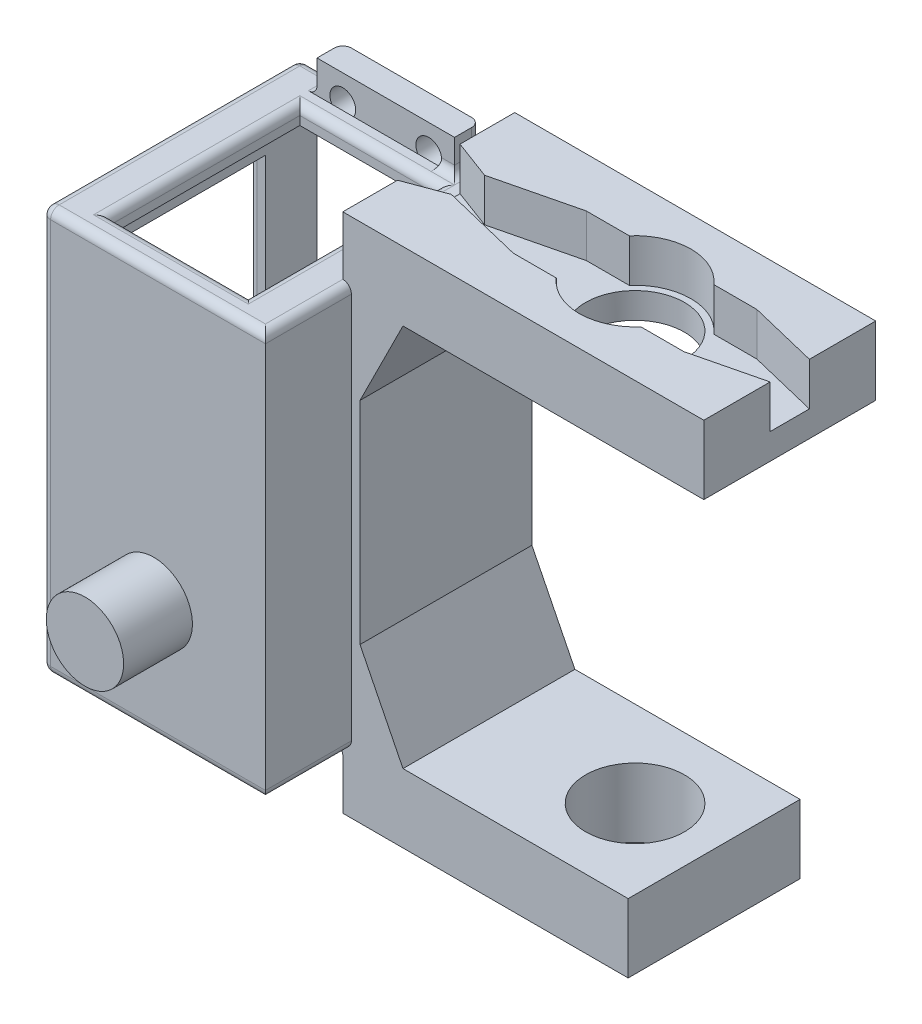
from build123d import *

# Parameters (mm, degrees)
SKETCH1_W               = 26
SKETCH1_H               = 47
BOSS_EXTRUDE1_DEPTH     = 30
SHELL1_T                = -2
SKETCH2_W               = 10
SKETCH2_H               = 0.8
BOSS_EXTRUDE2_DEPTH     = 3
SKETCH3_R               = 1.5
CUT_EXTRUDE1_DEPTH      = 3
BOSS_EXTRUDE3_DEPTH     = 20
CUT_EXTRUDE2_DEPTH      = 82.134209801
CUT_EXTRUDE2_DEPTH_BACK = 82.134209801
SKETCH6_R               = 4.5
BOSS_EXTRUDE4_DEPTH     = 8
CUT_EXTRUDE3_DEPTH      = 82.917275345
CUT_EXTRUDE3_DEPTH_BACK = 82.917275345
SKETCH9_R               = 5.75
CUT_EXTRUDE4_DEPTH      = 5
SKETCH10_W              = 18
SKETCH10_H              = 35
CUT_EXTRUDE5_DEPTH      = 5
FILLET1_R               = 1
FILLET2_R               = 1
FILLET3_R               = 1
FILLET5_R               = 1
FILLET6_R               = 1
SKETCH11_W              = 8.801922924
SKETCH11_H              = 20
CUT_EXTRUDE6_DEPTH      = 10
SKETCH12_R              = 109.313079142
CUT_EXTRUDE7_DEPTH      = 73.650464555


# Some blends are built 0.0001 mm under size
with BuildPart() as part:
    # Sketch1 → Boss-Extrude1 (new body)
    with BuildSketch(Plane.XY):
        Rectangle(SKETCH1_W, SKETCH1_H)
    extrude(amount=BOSS_EXTRUDE1_DEPTH)

    # Shell1
    shell1_openings = [part.faces().sort_by_distance(p)[0] for p in [
        (0, 0, 30),
    ]]
    offset(amount=SHELL1_T, openings=shell1_openings, kind=Kind.INTERSECTION)

    # Sketch2 → Boss-Extrude2 (add)
    with BuildSketch(Plane.XY.offset(30)):
        Polygon((-5, 23.5), (-5, 24.3), (5, 24.3), (5, 23.5), (8, 23.5), (8, 27.3), (-8, 27.3), (-8, 23.5), align=None)
        with Locations((0, 23.9)):
            Rectangle(SKETCH2_W, SKETCH2_H)
        Polygon((-5, -24.3), (-5, -23.5), (-8, -23.5), (-8, -27.3), (8, -27.3), (8, -23.5), (5, -23.5), (5, -24.3), align=None)
        with Locations((0, -23.9)):
            Rectangle(SKETCH2_W, SKETCH2_H)
    extrude(amount=-BOSS_EXTRUDE2_DEPTH)

    # Sketch3 → Cut-Extrude1 (cut)
    with BuildSketch(Plane.XY.offset(30)):
        with Locations((-5, -24.3)):
            Circle(SKETCH3_R)
        with Locations((5, -24.3)):
            Circle(SKETCH3_R)
        with Locations((5, 24.3)):
            Circle(SKETCH3_R)
        with Locations((-5, 24.3)):
            Circle(SKETCH3_R)
    extrude(amount=-CUT_EXTRUDE1_DEPTH, mode=Mode.SUBTRACT)

    # Sketch4 → Boss-Extrude3 (add)
    with BuildSketch(Plane.XY.offset(30)):
        Polygon((13, 23.5), (13, -23.5), (12, -23.5), (12, -30.3), (54, -30.3), (54, -22.3), (19, -22.3), (14, -12.3), (14, 12.3), (19, 22.3), (54, 22.3), (54, 30.3), (12, 30.3), (12, 23.5), align=None)
    extrude(amount=-BOSS_EXTRUDE3_DEPTH)

    # Sketch5 → Cut-Extrude2 (cut, two sides: drawn at the far end of the back side and taken through both)
    with BuildSketch(Plane(origin=(0, 22.3, 0), x_dir=(-1, 0, 0), z_dir=(0, -1, 0)).offset(-CUT_EXTRUDE2_DEPTH_BACK)):
        with BuildLine():
            ThreePointArc((-36, -14.25), (-41.75, -20), (-36, -25.75))
            Line((-36, -25.75), (-36, -14.25))
        make_face()
        with BuildLine():
            Line((-36, -14.25), (-36, -25.75))
            ThreePointArc((-36, -25.75), (-31.934136008, -24.065863992), (-30.25, -20))
            ThreePointArc((-30.25, -20), (-31.934136008, -15.934136008), (-36, -14.25))
        make_face()
    extrude(amount=CUT_EXTRUDE2_DEPTH + CUT_EXTRUDE2_DEPTH_BACK, mode=Mode.SUBTRACT)

    # Sketch6 → Boss-Extrude4 (add)
    with BuildSketch(Plane(origin=(0, 0, 0), x_dir=(-1, 0, 0), z_dir=(0, 0, -1))):
        with Locations((0, -10)):
            Circle(SKETCH6_R)
    extrude(amount=BOSS_EXTRUDE4_DEPTH)

    # Sketch7 → Cut-Extrude3 (cut, two sides: drawn at the far end of the back side and taken through both)
    with BuildSketch(Plane(origin=(0, 23.5, 0), x_dir=(1, 0, 0), z_dir=(0, 1, 0)).offset(-CUT_EXTRUDE3_DEPTH_BACK)):
        Polygon((-8, -25), (8, -25), (8, -23), (8, -5), (8, -3), (-8, -3), (-8, -5), (-8, -23), align=None)
    extrude(amount=CUT_EXTRUDE3_DEPTH + CUT_EXTRUDE3_DEPTH_BACK, mode=Mode.SUBTRACT)

    # Sketch9 → Cut-Extrude4 (cut)
    with BuildSketch(Plane(origin=(0, 30.3, 0), x_dir=(1, 0, 0), z_dir=(0, 1, 0))):
        with BuildLine():
            Line((31.081921107, -15.75), (26.081921107, -15.75))
            Line((26.081921107, -15.75), (16.559525756, -18.066028235))
            Line((16.559525756, -18.066028235), (12, -16.361741342))
            Line((12, -16.361741342), (12, -23.638258658))
            Line((12, -23.638258658), (16.559525756, -21.933971765))
            Line((16.559525756, -21.933971765), (26.081921107, -24.25))
            Line((26.081921107, -24.25), (31.081921107, -24.25))
            ThreePointArc((31.081921107, -24.25), (36, -26.5), (40.918078893, -24.25))
            Line((40.918078893, -24.25), (45.918078893, -24.25))
            Line((45.918078893, -24.25), (54, -22.284322585))
            Line((54, -22.284322585), (54, -17.715677415))
            Line((54, -17.715677415), (45.918078893, -15.75))
            Line((45.918078893, -15.75), (40.918078893, -15.75))
            ThreePointArc((40.918078893, -15.75), (36, -13.5), (31.081921107, -15.75))
        make_face()
        with Locations(Location((36, -20, 0), (0, 0, 90))):
            Circle(SKETCH9_R, mode=Mode.SUBTRACT)
    extrude(amount=-CUT_EXTRUDE4_DEPTH, mode=Mode.SUBTRACT)

    # Sketch10 → Cut-Extrude5 (cut)
    with BuildSketch(Plane.ZY.offset(13)):
        with Locations((15, 0)):
            Rectangle(SKETCH10_W, SKETCH10_H)
    extrude(amount=-CUT_EXTRUDE5_DEPTH, mode=Mode.SUBTRACT)

    # Fillet1
    fillet1_edges = [part.edges().sort_by_distance(p)[0] for p in [
        (0, -21.5, 30),
        (-13, 17.5, 15),
        (-13, 0, 24),
        (-13, 0, 6),
        (-13, -17.5, 15),
    ]]
    fillet(fillet1_edges, radius=FILLET1_R)

    # Fillet2
    # the kernel refuses this fillet: 1 mm, written as the material it adds along each edge
    with BuildSketch(Plane(origin=(8, 23.5, 30), x_dir=(1, 0, 0), z_dir=(0, 0, -1))) as fillet2_piece_1:
        with BuildLine():
            CenterArc((FILLET2_R, -FILLET2_R), FILLET2_R, 90, 90)
            Line((0, -FILLET2_R), (-FILLET2_R * 0.02, -FILLET2_R))
            Line((-FILLET2_R * 0.02, -FILLET2_R), (-FILLET2_R * 0.02, FILLET2_R * 0.02))
            Line((-FILLET2_R * 0.02, FILLET2_R * 0.02), (FILLET2_R, FILLET2_R * 0.02))
            Line((FILLET2_R, FILLET2_R * 0.02), (FILLET2_R, 0))
        make_face()
    extrude(amount=3)
    with BuildSketch(Plane(origin=(-8, 23.5, 30), x_dir=(-1, 0, 0), z_dir=(0, 0, -1))) as fillet2_piece_2:
        with BuildLine():
            CenterArc((FILLET2_R, FILLET2_R), FILLET2_R, 180, 90)
            Line((0, FILLET2_R), (-FILLET2_R * 0.02, FILLET2_R))
            Line((-FILLET2_R * 0.02, FILLET2_R), (-FILLET2_R * 0.02, -FILLET2_R * 0.02))
            Line((-FILLET2_R * 0.02, -FILLET2_R * 0.02), (FILLET2_R, -FILLET2_R * 0.02))
            Line((FILLET2_R, -FILLET2_R * 0.02), (FILLET2_R, 0))
        make_face()
    extrude(amount=3)
    with BuildSketch(Plane(origin=(3.768857754, 23.5, 27), x_dir=(0, 0, -1), z_dir=(1, 0, 0))) as fillet2_piece_3_section:
        with BuildLine():
            CenterArc((FILLET2_R, FILLET2_R), FILLET2_R, 180, 90)
            Line((0, FILLET2_R), (-FILLET2_R * 0.02, FILLET2_R))
            Line((-FILLET2_R * 0.02, FILLET2_R), (-FILLET2_R * 0.02, -FILLET2_R * 0.02))
            Line((-FILLET2_R * 0.02, -FILLET2_R * 0.02), (FILLET2_R, -FILLET2_R * 0.02))
            Line((FILLET2_R, -FILLET2_R * 0.02), (FILLET2_R, 0))
        make_face()
    fillet2_piece_3 = extrude(amount=4.231142246, mode=Mode.PRIVATE)
    fillet2_piece_3 = split(fillet2_piece_3, bisect_by=Plane(origin=(7.179036581, 23.695460756, 27), z_dir=(0, 0, -1)), keep=Keep.TOP, mode=Mode.PRIVATE)
    fillet2_piece_3 = fillet2_piece_3 - Plane(origin=(5, 24.3, 26.747269996), x_dir=(1, 0, 0), z_dir=(0, 0, 1)) * Cylinder(1.5, 13, mode=Mode.PRIVATE)
    add(fillet2_piece_3)
    with BuildSketch(Plane(origin=(12, -23.5, 30), x_dir=(0, -1, 0), z_dir=(0, 0, -1))) as fillet2_piece_4:
        with BuildLine():
            CenterArc((FILLET2_R, FILLET2_R), FILLET2_R, 180, 90)
            Line((0, FILLET2_R), (-FILLET2_R * 0.02, FILLET2_R))
            Line((-FILLET2_R * 0.02, FILLET2_R), (-FILLET2_R * 0.02, -FILLET2_R * 0.02))
            Line((-FILLET2_R * 0.02, -FILLET2_R * 0.02), (FILLET2_R, -FILLET2_R * 0.02))
            Line((FILLET2_R, -FILLET2_R * 0.02), (FILLET2_R, 0))
        make_face()
    extrude(amount=20)
    with BuildSketch(Plane(origin=(8, 23.5, 30), x_dir=(1, 0, 0), z_dir=(0, 0, -1))) as fillet2_piece_5a_section:
        with BuildLine():
            CenterArc((FILLET2_R, -FILLET2_R), FILLET2_R, 90, 90)
            Line((0, -FILLET2_R), (-FILLET2_R * 0.02, -FILLET2_R))
            Line((-FILLET2_R * 0.02, -FILLET2_R), (-FILLET2_R * 0.02, FILLET2_R * 0.02))
            Line((-FILLET2_R * 0.02, FILLET2_R * 0.02), (FILLET2_R, FILLET2_R * 0.02))
            Line((FILLET2_R, FILLET2_R * 0.02), (FILLET2_R, 0))
        make_face()
    fillet2_piece_5a = extrude(amount=5.5, mode=Mode.PRIVATE)
    fillet2_piece_5a = split(fillet2_piece_5a, bisect_by=Plane(origin=(8.226395114, 23.726395114, 27), z_dir=(0, 0, -1)), keep=Keep.TOP, mode=Mode.PRIVATE)
    with BuildSketch(Plane(origin=(3.768857754, 23.5, 27), x_dir=(0, 0, -1), z_dir=(1, 0, 0))) as fillet2_piece_5b_section:
        with BuildLine():
            CenterArc((FILLET2_R, FILLET2_R), FILLET2_R, 180, 90)
            Line((0, FILLET2_R), (-FILLET2_R * 0.02, FILLET2_R))
            Line((-FILLET2_R * 0.02, FILLET2_R), (-FILLET2_R * 0.02, -FILLET2_R * 0.02))
            Line((-FILLET2_R * 0.02, -FILLET2_R * 0.02), (FILLET2_R, -FILLET2_R * 0.02))
            Line((FILLET2_R, -FILLET2_R * 0.02), (FILLET2_R, 0))
        make_face()
    fillet2_piece_5b = extrude(amount=6.731142246, mode=Mode.PRIVATE)
    fillet2_piece_5b = split(fillet2_piece_5b, bisect_by=Plane(origin=(9.25, 23.70347313, 27), z_dir=(0, 0, -1)), keep=Keep.TOP, mode=Mode.PRIVATE)
    fillet2_piece_5b = split(fillet2_piece_5b, bisect_by=Plane(origin=(8, 23.70347313, 26.75304895), z_dir=(1, 0, 0)), keep=Keep.TOP, mode=Mode.PRIVATE)
    fillet2_piece_5 = fillet2_piece_5a & fillet2_piece_5b
    add(fillet2_piece_5)

    # Fillet3
    # the kernel refuses this fillet: 1 mm, written as the material it adds along each edge
    with BuildSketch(Plane(origin=(-8, -23.5, 30), x_dir=(-1, 0, 0), z_dir=(0, 0, -1))) as fillet3_piece_1:
        with BuildLine():
            CenterArc((FILLET3_R, -FILLET3_R), FILLET3_R, 90, 90)
            Line((0, -FILLET3_R), (-FILLET3_R * 0.02, -FILLET3_R))
            Line((-FILLET3_R * 0.02, -FILLET3_R), (-FILLET3_R * 0.02, FILLET3_R * 0.02))
            Line((-FILLET3_R * 0.02, FILLET3_R * 0.02), (FILLET3_R, FILLET3_R * 0.02))
            Line((FILLET3_R, FILLET3_R * 0.02), (FILLET3_R, 0))
        make_face()
    extrude(amount=3)
    with BuildSketch(Plane(origin=(8, -23.5, 30), x_dir=(1, 0, 0), z_dir=(0, 0, -1))) as fillet3_piece_2:
        with BuildLine():
            CenterArc((FILLET3_R, FILLET3_R), FILLET3_R, 180, 90)
            Line((0, FILLET3_R), (-FILLET3_R * 0.02, FILLET3_R))
            Line((-FILLET3_R * 0.02, FILLET3_R), (-FILLET3_R * 0.02, -FILLET3_R * 0.02))
            Line((-FILLET3_R * 0.02, -FILLET3_R * 0.02), (FILLET3_R, -FILLET3_R * 0.02))
            Line((FILLET3_R, -FILLET3_R * 0.02), (FILLET3_R, 0))
        make_face()
    extrude(amount=3)
    with BuildSketch(Plane(origin=(-3.768857754, -23.5, 27), x_dir=(0, 0, -1), z_dir=(-1, 0, 0))) as fillet3_piece_3_section:
        with BuildLine():
            CenterArc((FILLET3_R, FILLET3_R), FILLET3_R, 180, 90)
            Line((0, FILLET3_R), (-FILLET3_R * 0.02, FILLET3_R))
            Line((-FILLET3_R * 0.02, FILLET3_R), (-FILLET3_R * 0.02, -FILLET3_R * 0.02))
            Line((-FILLET3_R * 0.02, -FILLET3_R * 0.02), (FILLET3_R, -FILLET3_R * 0.02))
            Line((FILLET3_R, -FILLET3_R * 0.02), (FILLET3_R, 0))
        make_face()
    fillet3_piece_3 = extrude(amount=4.231142246, mode=Mode.PRIVATE)
    fillet3_piece_3 = split(fillet3_piece_3, bisect_by=Plane(origin=(-7.179037039, -23.695460726, 27), z_dir=(0, 0, -1)), keep=Keep.TOP, mode=Mode.PRIVATE)
    fillet3_piece_3 = fillet3_piece_3 - Plane(origin=(-5, -24.3, 26.747269962), x_dir=(1, 0, 0), z_dir=(0, 0, 1)) * Cylinder(1.5, 13, mode=Mode.PRIVATE)
    add(fillet3_piece_3)
    with BuildSketch(Plane(origin=(-3.768857754, -23.5, 27), x_dir=(0, 0, -1), z_dir=(-1, 0, 0))) as fillet3_piece_4a_section:
        with BuildLine():
            CenterArc((FILLET3_R, FILLET3_R), FILLET3_R, 180, 90)
            Line((0, FILLET3_R), (-FILLET3_R * 0.02, FILLET3_R))
            Line((-FILLET3_R * 0.02, FILLET3_R), (-FILLET3_R * 0.02, -FILLET3_R * 0.02))
            Line((-FILLET3_R * 0.02, -FILLET3_R * 0.02), (FILLET3_R, -FILLET3_R * 0.02))
            Line((FILLET3_R, -FILLET3_R * 0.02), (FILLET3_R, 0))
        make_face()
    fillet3_piece_4a = extrude(amount=6.731142246, mode=Mode.PRIVATE)
    fillet3_piece_4a = split(fillet3_piece_4a, bisect_by=Plane(origin=(-9.25, -23.70347313, 27), z_dir=(0, 0, -1)), keep=Keep.TOP, mode=Mode.PRIVATE)
    fillet3_piece_4a = split(fillet3_piece_4a, bisect_by=Plane(origin=(-8, -23.70347313, 26.75304895), z_dir=(-1, 0, 0)), keep=Keep.TOP, mode=Mode.PRIVATE)
    with BuildSketch(Plane(origin=(-8, -23.5, 30), x_dir=(-1, 0, 0), z_dir=(0, 0, -1))) as fillet3_piece_4b_section:
        with BuildLine():
            CenterArc((FILLET3_R, -FILLET3_R), FILLET3_R, 90, 90)
            Line((0, -FILLET3_R), (-FILLET3_R * 0.02, -FILLET3_R))
            Line((-FILLET3_R * 0.02, -FILLET3_R), (-FILLET3_R * 0.02, FILLET3_R * 0.02))
            Line((-FILLET3_R * 0.02, FILLET3_R * 0.02), (FILLET3_R, FILLET3_R * 0.02))
            Line((FILLET3_R, FILLET3_R * 0.02), (FILLET3_R, 0))
        make_face()
    fillet3_piece_4b = extrude(amount=5.5, mode=Mode.PRIVATE)
    fillet3_piece_4b = split(fillet3_piece_4b, bisect_by=Plane(origin=(-8.226395114, -23.726395114, 27), z_dir=(0, 0, -1)), keep=Keep.TOP, mode=Mode.PRIVATE)
    fillet3_piece_4 = fillet3_piece_4a & fillet3_piece_4b
    add(fillet3_piece_4)

    # Fillet5
    fillet5_edges = [part.edges().sort_by_distance(p)[0] for p in [
        (-8, 25.9, 30),
        (-8.292893219, 23.792893219, 30),
        (-13, 23.5, 15),
        (-13, 0, 0),
        (13, 23.5, 5),
        (-11, 23.5, 30),
        (-13, -23.5, 15),
        (0, -23.5, 0),
        (13, -23.5, 5),
        (-13, 0, 30),
        (0, 23.5, 0),
        (10.5, 23.5, 30),
        (8, 25.9, 30),
        (0, -23.5, 25),
        (-8, -23.5, 14),
        (0, -23.5, 3),
        (8, -23.5, 14),
        (-8, 23.5, 14),
        (0, 23.5, 25),
        (8, 23.5, 14),
        (0, 23.5, 3),
        (8.292893219, 23.792893219, 30),
    ]]
    fillet(fillet5_edges, radius=FILLET5_R - 0.0001)  # a hair under: the kernel refuses the full size

    # Fillet6
    fillet6_edges = [part.edges().sort_by_distance(p)[0] for p in [
        (0, 21.5, 30),
    ]]
    fillet(fillet6_edges, radius=FILLET6_R)

    # Sketch11 → Cut-Extrude6 (cut)
    with BuildSketch(Plane.XZ.offset(30.3)):
        with Locations((49.599038538, 20)):
            Rectangle(SKETCH11_W, SKETCH11_H)
    extrude(amount=-CUT_EXTRUDE6_DEPTH, mode=Mode.SUBTRACT)


with BuildPart() as body_2:
    # Mirror2: mirrored copy
    add(part.part.mirror(Plane(origin=(0, 0, 30), x_dir=(1, 0, 0), z_dir=(0, 0, -1))))


with BuildPart() as part_1:
    add(part.part)

    # Sketch12 → Cut-Extrude7 (cut, through all)
    with BuildSketch(Plane(origin=(0, 0, 30), x_dir=(-1, 0, 0), z_dir=(0, 0, -1))):
        Circle(SKETCH12_R)
    extrude(amount=CUT_EXTRUDE7_DEPTH, mode=Mode.SUBTRACT)


solid = body_2.part
